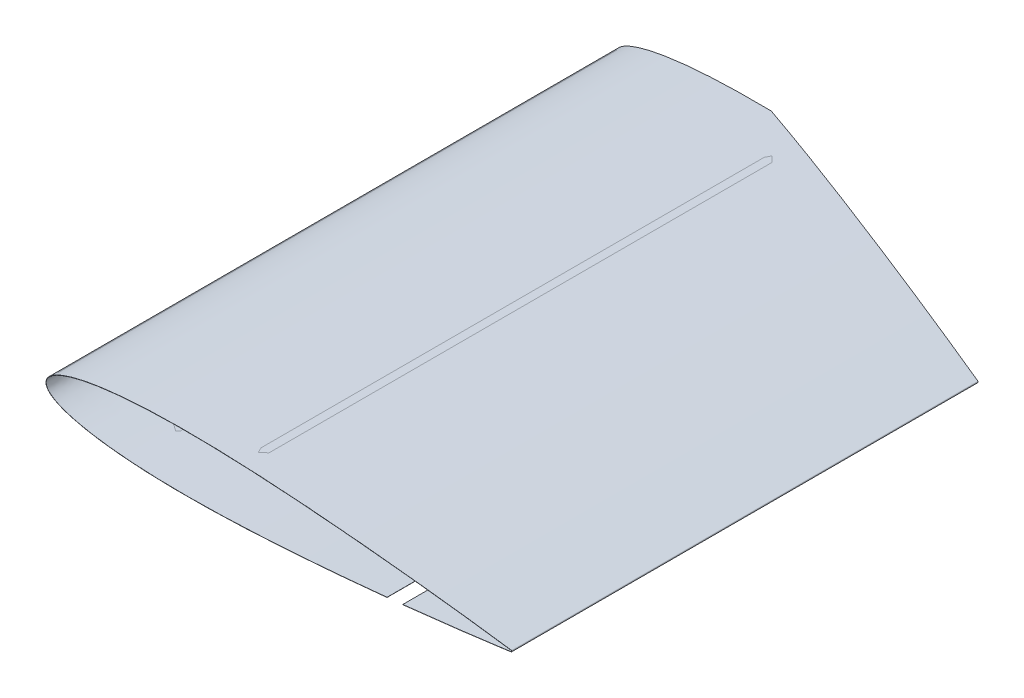
from build123d import *
from build123d.topology import SkipClean

# Parameters (mm, degrees)
BOSS_EXTRUDE1_DEPTH     = 279.908
CUT_EXTRUDE1_DEPTH      = 362.722218758
CUT_EXTRUDE1_DEPTH_BACK = 362.722218758
CUT_EXTRUDE4_DEPTH      = 362.722218758
CUT_EXTRUDE4_DEPTH_BACK = 279.908


# Read off the part's stored shape, not the designer's step: Boss-Extrude1
with BuildPart() as part:
    # Boss-Extrude1 outline → Boss-Extrude1 (new body)
    with BuildSketch(Plane.XY):
        with BuildLine():
            add(Edge.make_bspline(
                [(-0.1, 0), (-0.1, -0.622668485), (0.24292484, -1.868005454), (1.414195648, -3.332924479), (2.847838491, -4.494074227), (4.937826103, -5.769583321), (7.726213111, -7.014370964), (11.185045811, -8.192348852), (14.706628463, -9.155652461), (19.45184093, -10.230240043), (25.443334952, -11.269899104), (32.679402043, -12.187309962), (39.941566277, -12.853776799), (47.218346201, -13.320769508), (56.931616482, -13.723391683), (69.082811997, -13.88073441), (83.662026277, -13.6580142), (98.231939324, -13.115809794), (112.78957307, -12.320428251), (127.334131383, -11.32009649), (141.865723635, -10.150002522), (153.964870007, -9.053898252), (163.637979496, -8.112273603), (170.889682926, -7.374759079), (178.138209123, -6.60674194), (185.383485655, -5.808636813), (192.625359628, -4.980222039), (198.657285395, -4.264291275), (203.480912126, -3.675673641), (207.097649128, -3.226174251), (210.713352514, -2.768428625), (213.72555326, -2.379947915), (216.134744348, -2.064818345), (217.941353193, -1.826305054), (219.747694628, -1.585579962), (221.553640141, -1.342428199), (223.058528816, -1.138336076), (224.262091908, -0.973257176), (225.164389771, -0.848819216), (226.068212139, -0.726915594), (226.818810104, -0.616317777), (227.419241548, -0.537968062), (227.800594966, -0.489980445), (228.101559923, -0.436412279), (228.275197027, -0.40027755), (228.427036878, -0.416371604), (228.615369038, -0.334724063), (228.683783563, -0.172794734), (228.708108218, 0), (228.683783563, 0.172794734), (228.615369038, 0.334724063), (228.427036878, 0.416371604), (228.275197027, 0.40027755), (228.101559923, 0.436412279), (227.800594966, 0.489980445), (227.419241548, 0.537968062), (226.818810104, 0.616317777), (226.068212139, 0.726915594), (225.164389771, 0.848819216), (224.262091908, 0.973257176), (223.058528816, 1.138336076), (221.553640141, 1.342428199), (219.747694628, 1.585579962), (217.941353193, 1.826305054), (216.134744348, 2.064818345), (213.72555326, 2.379947915), (210.713352514, 2.768428625), (207.097649128, 3.226174251), (203.480912126, 3.675673641), (198.657285395, 4.264291275), (192.625359628, 4.980222039), (185.383485655, 5.808636813), (178.138209123, 6.60674194), (170.889682926, 7.374759079), (163.637979496, 8.112273603), (153.964870007, 9.053898252), (141.865723635, 10.150002522), (127.334131383, 11.32009649), (112.78957307, 12.320428251), (98.231939324, 13.115809794), (83.662026277, 13.6580142), (69.082811997, 13.88073441), (56.931616482, 13.723391683), (47.218346201, 13.320769508), (39.941566277, 12.853776799), (32.679402043, 12.187309962), (25.443334952, 11.269899104), (19.45184093, 10.230240043), (14.706628463, 9.155652461), (11.185045811, 8.192348852), (7.726213111, 7.014370964), (4.937826103, 5.769583321), (2.847838491, 4.494074227), (1.414195648, 3.332924479), (0.24292484, 1.868005454), (-0.1, 0.622668485), (-0.1, 0)],
                knots=[0, 0, 0, 0, 0.00390625, 0.0078125, 0.01171875, 0.015625, 0.0234375, 0.03125, 0.0390625, 0.046875, 0.0625, 0.078125, 0.09375, 0.109375, 0.125, 0.15625, 0.1875, 0.21875, 0.25, 0.28125, 0.3125, 0.34375, 0.359375, 0.375, 0.390625, 0.40625, 0.421875, 0.4375, 0.4453125, 0.453125, 0.4609375, 0.46875, 0.47265625, 0.4765625, 0.48046875, 0.484375, 0.48828125, 0.490234375, 0.4921875, 0.494140625, 0.49609375, 0.497070312, 0.498046875, 0.498535156, 0.499023438, 0.499267578, 0.499511719, 0.499755859, 0.5, 0.500244141, 0.500488281, 0.500732422, 0.500976562, 0.501464844, 0.501953125, 0.502929688, 0.50390625, 0.505859375, 0.5078125, 0.509765625, 0.51171875, 0.515625, 0.51953125, 0.5234375, 0.52734375, 0.53125, 0.5390625, 0.546875, 0.5546875, 0.5625, 0.578125, 0.59375, 0.609375, 0.625, 0.640625, 0.65625, 0.6875, 0.71875, 0.75, 0.78125, 0.8125, 0.84375, 0.875, 0.890625, 0.90625, 0.921875, 0.9375, 0.953125, 0.9609375, 0.96875, 0.9765625, 0.984375, 0.98828125, 0.9921875, 0.99609375, 1, 1, 1, 1], degree=3))
        make_face()
        with BuildLine():
            add(Edge.make_bspline(
                [(0, 0), (0, -0.328477994), (0.094132544, -1.002317273), (0.516328799, -1.979047664), (1.206253084, -2.919084286), (2.155530292, -3.826507135), (3.361088978, -4.704503454), (4.821173785, -5.55391213), (6.533647864, -6.373768076), (8.495474965, -7.162212853), (10.702763054, -7.916899641), (13.150800968, -8.635300083), (15.834201004, -9.314707599), (18.746872001, -9.952655748), (21.882185807, -10.546523838), (25.23289446, -11.094151144), (28.791264659, -11.593290214), (32.549019843, -12.042255982), (36.4974269, -12.43944474), (40.627278951, -12.783751315), (44.928952977, -13.074379275), (49.392427762, -13.310840666), (54.00728167, -13.493188322), (58.76274015, -13.621763124), (63.647705329, -13.697267659), (68.650780173, -13.72087076), (73.760279514, -13.693983832), (78.964273059, -13.618365131), (84.250609651, -13.496063622), (89.606956912, -13.329404125), (95.020804226, -13.120820839), (100.479505937, -12.87299727), (105.970317865, -12.588746266), (111.480424999, -12.270931467), (116.996960654, -11.922505449), (122.507041698, -11.546430916), (127.997806048, -11.145660598), (133.456428211, -10.723198576), (138.870163217, -10.281871752), (144.226358514, -9.824563044), (149.512524459, -9.354044127), (154.7162998, -8.873020616), (159.825543847, -8.384191905), (164.828306858, -7.890045542), (169.712928008, -7.393148198), (174.467978148, -6.895915808), (179.082363681, -6.400793333), (183.545298009, -5.91018943), (187.846354056, -5.426302321), (191.975503597, -4.951590796), (195.923094736, -4.488262398), (199.679907253, -4.038593513), (203.237156328, -3.604799783), (206.586548753, -3.189155079), (209.720252989, -2.793754916), (212.630956022, -2.420810863), (215.311847817, -2.072241054), (217.75667572, -1.750168635), (219.959752272, -1.4563836), (221.915845594, -1.192545194), (223.620666071, -0.960790622), (225.069395854, -0.760875596), (226.261037983, -0.598983787), (227.186433997, -0.462932704), (227.858906671, -0.385743815), (228.245225393, -0.302214543), (228.641481893, -0.309763383), (228.641481893, 0.309763383), (228.245225393, 0.302214543), (227.858906671, 0.385743815), (227.186433997, 0.462932704), (226.261037983, 0.598983787), (225.069395854, 0.760875596), (223.620666071, 0.960790622), (221.915845594, 1.192545194), (219.959752272, 1.4563836), (217.75667572, 1.750168635), (215.311847817, 2.072241054), (212.630956022, 2.420810863), (209.720252989, 2.793754916), (206.586548753, 3.189155079), (203.237156328, 3.604799783), (199.679907253, 4.038593513), (195.923094736, 4.488262398), (191.975503597, 4.951590796), (187.846354056, 5.426302321), (183.545298009, 5.91018943), (179.082363681, 6.400793333), (174.467978148, 6.895915808), (169.712928008, 7.393148198), (164.828306858, 7.890045542), (159.825543847, 8.384191905), (154.7162998, 8.873020616), (149.512524459, 9.354044127), (144.226358514, 9.824563044), (138.870163217, 10.281871752), (133.456428211, 10.723198576), (127.997806048, 11.145660598), (122.507041698, 11.546430916), (116.996960654, 11.922505449), (111.480424999, 12.270931467), (105.970317865, 12.588746266), (100.479505937, 12.87299727), (95.020804226, 13.120820839), (89.606956912, 13.329404125), (84.250609651, 13.496063622), (78.964273059, 13.618365131), (73.760279514, 13.693983832), (68.650780173, 13.72087076), (63.647705329, 13.697267659), (58.76274015, 13.621763124), (54.00728167, 13.493188322), (49.392427762, 13.310840666), (44.928952977, 13.074379275), (40.627278951, 12.783751315), (36.4974269, 12.43944474), (32.549019843, 12.042255982), (28.791264659, 11.593290214), (25.23289446, 11.094151144), (21.882185807, 10.546523838), (18.746872001, 9.952655748), (15.834201004, 9.314707599), (13.150800968, 8.635300083), (10.702763054, 7.916899641), (8.495474965, 7.162212853), (6.533647864, 6.373768076), (4.821173785, 5.55391213), (3.361088978, 4.704503454), (2.155530292, 3.826507135), (1.206253084, 2.919084286), (0.516328799, 1.979047664), (0.094132544, 1.002317273), (0, 0.328477994), (0, 0)],
                knots=[0, 0, 0, 0, 0.002106168, 0.00432059, 0.006772783, 0.009556697, 0.012734041, 0.016342888, 0.020405604, 0.024934102, 0.029933071, 0.035402241, 0.04133743, 0.04773159, 0.054575389, 0.061857405, 0.069564571, 0.077682311, 0.086194684, 0.095084441, 0.104333244, 0.1139217, 0.123829339, 0.134034708, 0.144515531, 0.155248716, 0.166210356, 0.177375783, 0.188719821, 0.200216647, 0.211839951, 0.223562989, 0.235358653, 0.247199625, 0.259058395, 0.270907226, 0.282718457, 0.294464514, 0.306117689, 0.317650771, 0.329036618, 0.34024851, 0.351259999, 0.362045273, 0.372578891, 0.382836142, 0.392792739, 0.40242532, 0.411711115, 0.420628244, 0.429155673, 0.437273179, 0.444961561, 0.452202575, 0.458979063, 0.465274876, 0.471074963, 0.476365569, 0.481133961, 0.485368768, 0.489059784, 0.492198148, 0.494776266, 0.49678801, 0.498228425, 0.499094073, 0.499382862, 0.500617138, 0.500905927, 0.501771575, 0.50321199, 0.505223734, 0.507801852, 0.510940216, 0.514631232, 0.518866039, 0.523634431, 0.528925037, 0.534725124, 0.541020937, 0.547797425, 0.555038439, 0.562726821, 0.570844327, 0.579371756, 0.588288885, 0.59757468, 0.607207261, 0.617163858, 0.627421109, 0.637954727, 0.648740001, 0.65975149, 0.670963382, 0.682349229, 0.693882311, 0.705535486, 0.717281543, 0.729092774, 0.740941605, 0.752800375, 0.764641347, 0.776437011, 0.788160049, 0.799783353, 0.811280179, 0.822624217, 0.833789644, 0.844751284, 0.855484469, 0.865965292, 0.876170661, 0.8860783, 0.895666756, 0.904915559, 0.913805316, 0.922317689, 0.930435429, 0.938142595, 0.945424611, 0.95226841, 0.95866257, 0.964597759, 0.970066929, 0.975065898, 0.979594396, 0.983657112, 0.987265959, 0.990443303, 0.993227217, 0.99567941, 0.997893832, 1, 1, 1, 1], degree=3))
        make_face(mode=Mode.SUBTRACT)
    extrude(amount=BOSS_EXTRUDE1_DEPTH)

    # Sketch2 → Cut-Extrude1 (cut, two sides: drawn at the far end of the back side and taken through both)
    with SkipClean():  # the faces are left unmerged after this step: merging them gives an invalid solid
        with BuildSketch(Plane(origin=(0, 0, 0), x_dir=(1, 0, 0), z_dir=(0, 1, 0)).offset(-CUT_EXTRUDE1_DEPTH_BACK)):
            Polygon((76.3, 0), (228.7, -50.8), (228.7, 0), align=None)
        extrude(amount=CUT_EXTRUDE1_DEPTH + CUT_EXTRUDE1_DEPTH_BACK, mode=Mode.SUBTRACT)

    # Sketch3 → Cut-Extrude4 (cut, two sides: drawn at the far end of the back side and taken through both)
    with BuildSketch(Plane.XY.offset(-CUT_EXTRUDE4_DEPTH_BACK)):
        Polygon((171.45, 7.210810422), (180.1743428, -25.348880169), (162.7256572, -25.348880169), align=None)
    extrude(amount=CUT_EXTRUDE4_DEPTH + CUT_EXTRUDE4_DEPTH_BACK, mode=Mode.SUBTRACT)


solid = part.part
